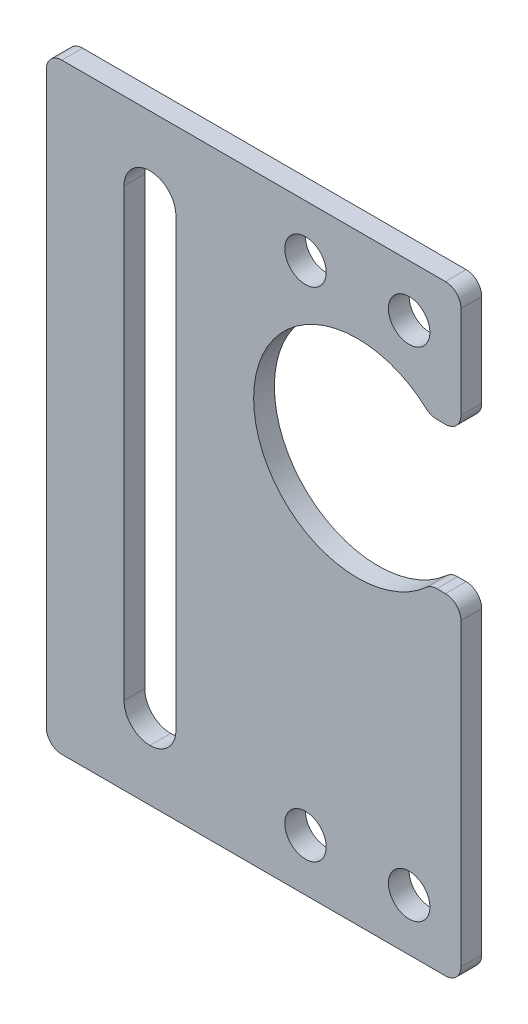
from build123d import *

# Parameters (mm, degrees)
SKETCH_1_R      = 2
EXTRUDE_1_DEPTH = 2
FILLET_1_R      = 1.5
FILLET_2_R      = 2.5


with BuildPart() as part:
    # 草图1 → 凸台-拉伸1 (new body)
    with BuildSketch(Plane.XY):
        with BuildLine():
            Line((7.071067812, 17.071067812), (10, 17.071067812))
            Line((10, 17.071067812), (10, 29))
            Line((10, 29), (-15, 29))
            Line((-15, 29), (-30, 29))
            Line((-30, 29), (-30, -29))
            Line((-30, -29), (-15, -29))
            Line((-15, -29), (10, -29))
            Line((10, -29), (10, 2.928932188))
            Line((10, 2.928932188), (7.071067812, 2.928932188))
            ThreePointArc((7.071067812, 2.928932188), (-10, 10), (7.071067812, 17.071067812))
        make_face()
        with Locations((5, -24)):
            Circle(SKETCH_1_R, mode=Mode.SUBTRACT)
        with Locations((-5, -24)):
            Circle(SKETCH_1_R, mode=Mode.SUBTRACT)
        with Locations((-5, 24)):
            Circle(SKETCH_1_R, mode=Mode.SUBTRACT)
        with Locations((5, 24)):
            Circle(SKETCH_1_R, mode=Mode.SUBTRACT)
        Polygon((-20, 24), (-17.5, 24), (-17.5, -24), (-22.5, -24), (-22.5, 24), align=None, mode=Mode.SUBTRACT)
    extrude(amount=EXTRUDE_1_DEPTH)

    # 圆角1
    fillet_1_edges = [part.edges().sort_by_distance(p)[0] for p in [
        (7.071067812, 2.928932188, 1),
        (10, 2.928932188, 1),
        (10, -29, 1),
        (-30, -29, 1),
        (-30, 29, 1),
        (10, 29, 1),
        (10, 17.071067812, 1),
        (7.071067812, 17.071067812, 1),
    ]]
    fillet(fillet_1_edges, radius=FILLET_1_R)

    # 圆角2
    fillet_2_edges = [part.edges().sort_by_distance(p)[0] for p in [
        (-17.5, -24, 1),
        (-22.5, -24, 1),
        (-22.5, 24, 1),
        (-17.5, 24, 1),
    ]]
    fillet(fillet_2_edges, radius=FILLET_2_R - 0.0001)  # a hair under: the kernel refuses the full size


solid = part.part
